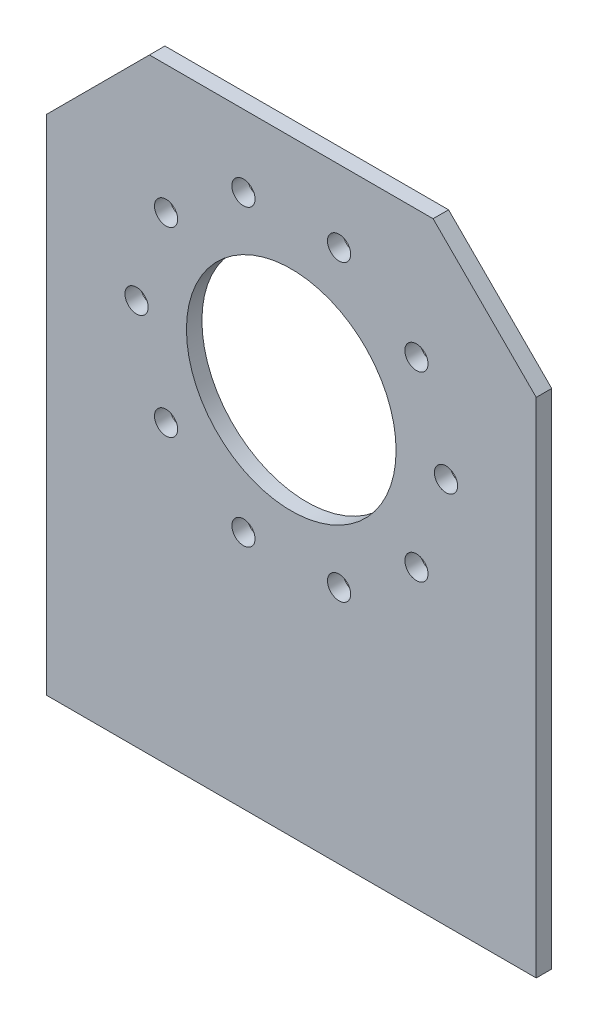
from build123d import *

# Parameters (mm, degrees)
SKETCH1_R           = 40.65
SKETCH1_R_2         = 4.5
BOSS_EXTRUDE1_DEPTH = 6


with BuildPart() as part:
    # Sketch1 → Boss-Extrude1 (new body)
    with BuildSketch(Plane.XY):
        Polygon((-95, 77.5), (-55, 117.5), (55, 117.5), (95, 77.5), (95, -117.5), (-95, -117.5), align=None)
        with Locations((0, 32.5)):
            Circle(SKETCH1_R, mode=Mode.SUBTRACT)
        with Locations((-60, 32.5)):
            Circle(SKETCH1_R_2, mode=Mode.SUBTRACT)
        with Locations((-48.541019662, 67.767115138)):
            Circle(SKETCH1_R_2, mode=Mode.SUBTRACT)
        with Locations((-18.541019662, 89.563390978)):
            Circle(SKETCH1_R_2, mode=Mode.SUBTRACT)
        with Locations((18.541019662, 89.563390978)):
            Circle(SKETCH1_R_2, mode=Mode.SUBTRACT)
        with Locations((48.541019662, 67.767115138)):
            Circle(SKETCH1_R_2, mode=Mode.SUBTRACT)
        with Locations((60, 32.5)):
            Circle(SKETCH1_R_2, mode=Mode.SUBTRACT)
        with Locations((48.541019662, -2.767115138)):
            Circle(SKETCH1_R_2, mode=Mode.SUBTRACT)
        with Locations((18.541019662, -24.563390978)):
            Circle(SKETCH1_R_2, mode=Mode.SUBTRACT)
        with Locations((-18.541019662, -24.563390978)):
            Circle(SKETCH1_R_2, mode=Mode.SUBTRACT)
        with Locations((-48.541019662, -2.767115138)):
            Circle(SKETCH1_R_2, mode=Mode.SUBTRACT)
    extrude(amount=BOSS_EXTRUDE1_DEPTH)


solid = part.part
